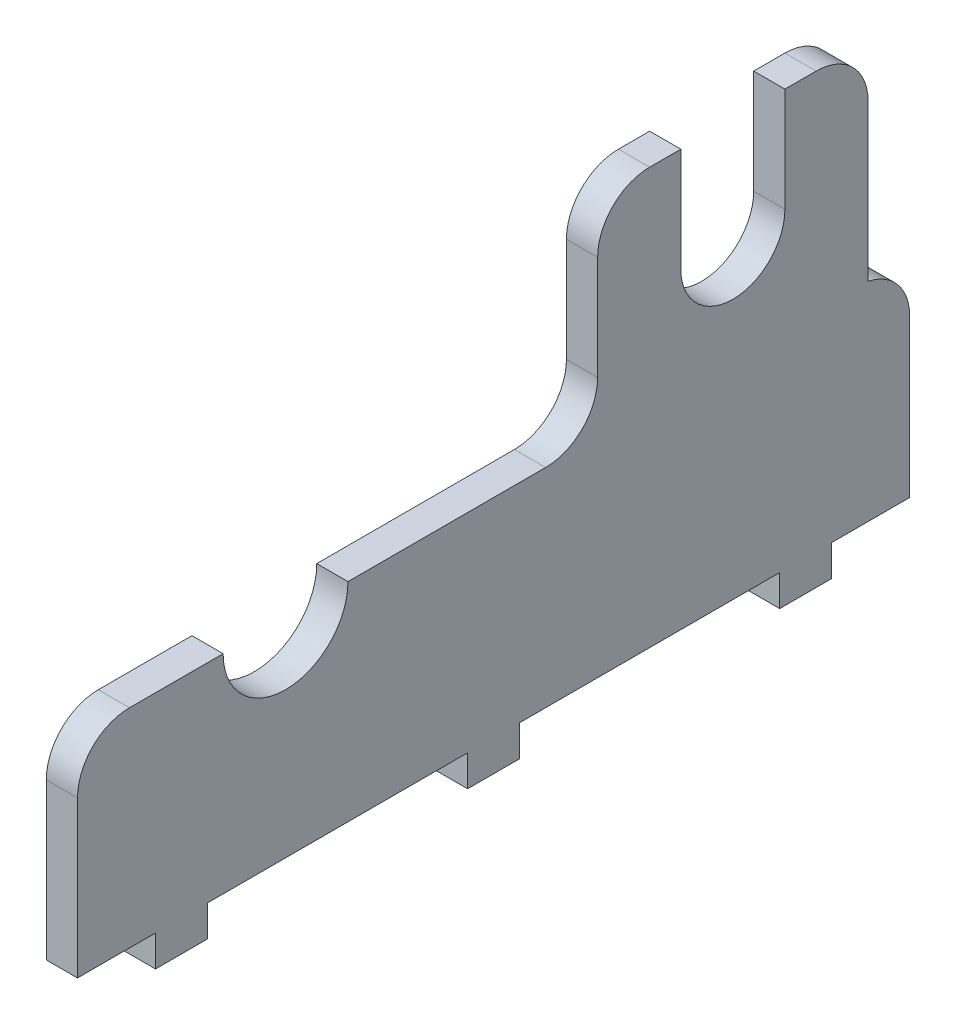
from build123d import *

# Parameters (mm, degrees)
SKETCH1_W           = 80
SKETCH1_H           = 40
BOSS_EXTRUDE1_DEPTH = 3
SKETCH2_R           = 6
CUT_EXTRUDE1_DEPTH  = 65.101482042
SKETCH5_W           = 4
SKETCH5_H           = 20
SKETCH5_W_2         = 51.247459446
CUT_EXTRUDE2_DEPTH  = 65.101482042
FILLET1_R           = 5
SKETCH6_W           = 3
SKETCH6_H           = 5
BOSS_EXTRUDE2_DEPTH = 3
LPATTERN1_COUNT     = 3
LPATTERN1_PITCH     = 30


with BuildPart() as part:
    # Sketch1 → Boss-Extrude1 (new body)
    with BuildSketch(Plane(origin=(0, 0, 0), x_dir=(0, 0, -1), z_dir=(1, 0, 0))):
        with Locations((10, 20)):
            Rectangle(SKETCH1_W, SKETCH1_H)
    extrude(amount=BOSS_EXTRUDE1_DEPTH)

    # Sketch2 → Cut-Extrude1 (cut, through all)
    with BuildSketch(Plane(origin=(3, 0, 0), x_dir=(0, 0, -1), z_dir=(1, 0, 0))):
        with Locations((-10, 20)):
            Circle(SKETCH2_R)
    extrude(amount=-CUT_EXTRUDE1_DEPTH, mode=Mode.SUBTRACT)

    # Sketch5 → Cut-Extrude2 (cut, through all)
    with BuildSketch(Plane.ZY):
        with BuildLine():
            Line((-28, 30), (-28, 40))
            Line((-28, 40), (-38, 40))
            Line((-38, 40), (-38, 30))
            ThreePointArc((-38, 30), (-33, 25), (-28, 30))
        make_face()
        with Locations((-48, 30)):
            Rectangle(SKETCH5_W, SKETCH5_H)
        with Locations((5.623729723, 30)):
            Rectangle(SKETCH5_W_2, SKETCH5_H)
    extrude(amount=-CUT_EXTRUDE2_DEPTH, mode=Mode.SUBTRACT)

    # Fillet1
    # the kernel refuses this fillet: 5 mm, written as the material it adds along each edge
    with BuildSketch(Plane(origin=(0, 20, -20), x_dir=(0, 1, 0), z_dir=(1, 0, 0))) as fillet1_piece_1:
        with BuildLine():
            CenterArc((FILLET1_R, FILLET1_R), FILLET1_R, 180, 90)
            Line((0, FILLET1_R), (0, 0))
            Line((0, 0), (FILLET1_R, 0))
        make_face()
    extrude(amount=3)
    # the kernel refuses this fillet: 5 mm, written as the material it takes off along each edge
    with BuildSketch(Plane(origin=(-12.5, 40, -46), x_dir=(0, -1, 0), z_dir=(1, 0, 0)), Plane(origin=(-12.5, 40, -20), x_dir=(0, 0, -1), z_dir=(1, 0, 0)), Plane(origin=(15.5, 20, 30), x_dir=(0, -1, 0), z_dir=(-1, 0, 0))) as fillet1_2_piece_1:
        with BuildLine():
            CenterArc((FILLET1_R, -FILLET1_R), FILLET1_R, 90, 90)
            Line((0, -FILLET1_R), (0, 0))
            Line((0, 0), (FILLET1_R, 0))
        make_face()
    extrude(amount=28, mode=Mode.SUBTRACT)
    with BuildSketch(Plane(origin=(-12.247448714, 20, -50), x_dir=(0, -1, 0), z_dir=(1, 0, 0))) as fillet1_2_piece_2:
        with BuildLine():
            CenterArc((4.898979486, -5), FILLET1_R, 90, 78.463040967)
            Line((0, -4), (0, 0))
            Line((0, 0), (4.898979486, 0))
        make_face()
    extrude(amount=27.494897428, mode=Mode.SUBTRACT)

    # Sketch6 → Boss-Extrude2 (add)
    with BuildSketch(Plane.XZ):
        with Locations((1.5, 20)):
            Rectangle(SKETCH6_W, SKETCH6_H)
    boss_extrude2 = extrude(amount=BOSS_EXTRUDE2_DEPTH)

    # LPattern1: Boss-Extrude2 ×3
    with Locations(*[(0, 0, -i * LPATTERN1_PITCH) for i in range(1, LPATTERN1_COUNT)]):
        add(boss_extrude2)


solid = part.part
